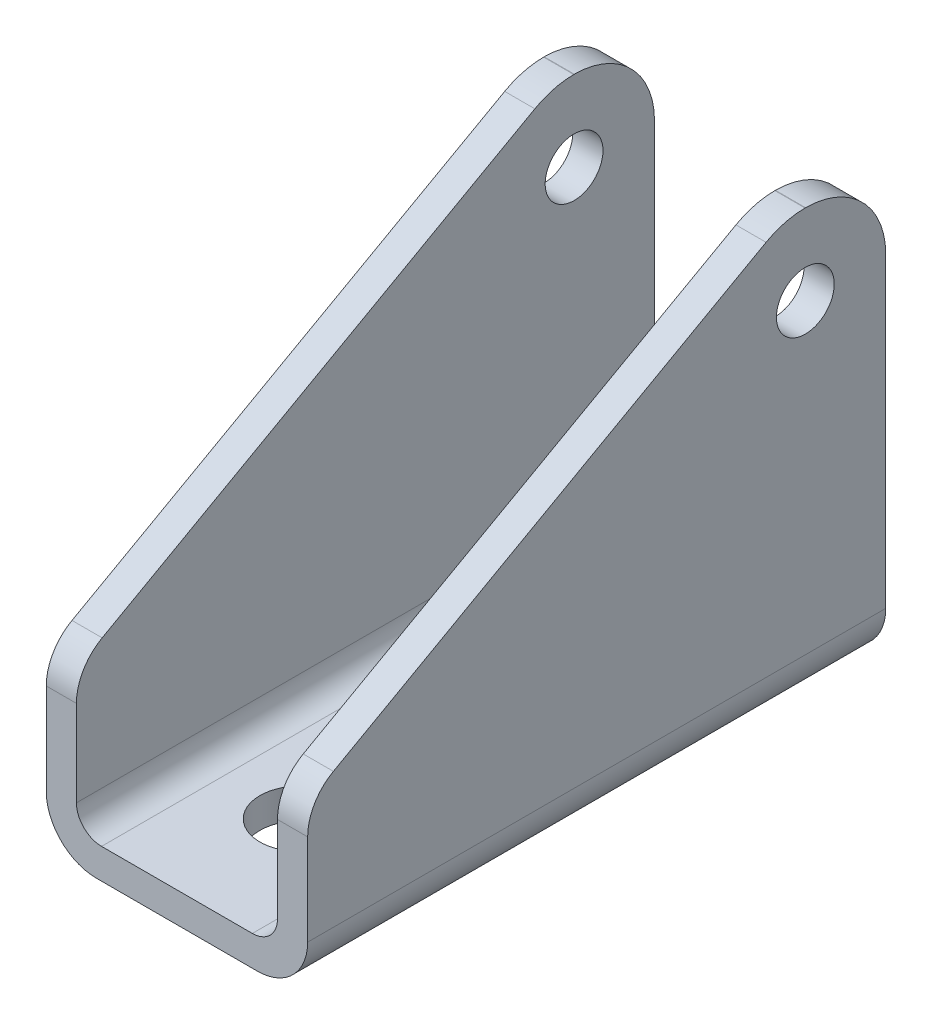
from build123d import *

# Parameters (mm, degrees)
BOSS_EXTRUDE1_DEPTH = 58.42
FILLET1_R           = 2.54
FILLET2_R           = 5.08
CUT_EXTRUDE1_START  = -26.416
CUT_EXTRUDE1_DEPTH  = 26.416
CUT_EXTRUDE2_START  = -26.416
CUT_EXTRUDE2_DEPTH  = 26.416
SKETCH2_5_R         = 2.921
CUT_EXTRUDE3_DEPTH  = 58.42
FILLET3_R           = 5.08
SKETCH4_R           = 4.064
CUT_EXTRUDE4_DEPTH  = 58.42


# Read off the part's stored shape, not the designer's step: Cut-Extrude1, Cut-Extrude2
with BuildPart() as part:
    # Sketch1 → Boss-Extrude1 (new body)
    with BuildSketch(Plane.XY):
        Polygon((-15.613299977, -11.899049236), (10.802700023, -11.899049236), (10.802700023, 32.296950764), (7.754700023, 32.296950764), (7.754700023, -8.851049236), (-12.565299977, -8.851049236), (-12.565299977, 32.296950764), (-15.613299977, 32.296950764), align=None)
    extrude(amount=-BOSS_EXTRUDE1_DEPTH)

    # Fillet1
    fillet1_edges = [part.edges().sort_by_distance(p)[0] for p in [
        (-12.565299977, -8.851049236, -29.21),
        (7.754700023, -8.851049236, -29.21),
    ]]
    fillet(fillet1_edges, radius=FILLET1_R)

    # Fillet2
    fillet2_edges = [part.edges().sort_by_distance(p)[0] for p in [
        (10.802700023, -11.899049236, -29.21),
        (-15.613299977, -11.899049236, -29.21),
    ]]
    fillet(fillet2_edges, radius=FILLET2_R)

    # Cut-Extrude1 outline → Cut-Extrude1 (cut)
    with BuildSketch(Plane(origin=(10.802700023, 0, 0), x_dir=(0, 0, -1), z_dir=(1, 0, 0)).offset(CUT_EXTRUDE1_START)):
        with BuildLine():
            Line((0, 32.296950764), (0, 5.372950764))
            Line((0, 5.372950764), (46.326645987, 31.26409951))
            ThreePointArc((46.326645987, 31.26409951), (48.229617736, 32.030995509), (50.263996941, 32.296950764))
            Line((50.263996941, 32.296950764), (0, 32.296950764))
        make_face()
    extrude(amount=CUT_EXTRUDE1_DEPTH, mode=Mode.SUBTRACT)

    # Cut-Extrude2 outline → Cut-Extrude2 (cut)
    with BuildSketch(Plane(origin=(10.802700023, 0, 0), x_dir=(0, 0, -1), z_dir=(1, 0, 0)).offset(CUT_EXTRUDE2_START)):
        with BuildLine():
            ThreePointArc((50.320003059, 32.296950764), (56.039398027, 29.916348791), (58.42, 24.196953823))
            Line((58.42, 24.196953823), (58.42, 32.296950764))
            Line((58.42, 32.296950764), (50.320003059, 32.296950764))
        make_face()
    extrude(amount=CUT_EXTRUDE2_DEPTH, mode=Mode.SUBTRACT)

    # Sketch2<5> → Cut-Extrude3 (cut)
    with BuildSketch(Plane(origin=(10.802700023, 0, 0), x_dir=(0, 0, -1), z_dir=(1, 0, 0))):
        with Locations((50.292, 24.168950764)):
            Circle(SKETCH2_5_R)
    extrude(amount=-CUT_EXTRUDE3_DEPTH, mode=Mode.SUBTRACT)

    # Fillet3
    fillet3_edges = [part.edges().sort_by_distance(p)[0] for p in [
        (-14.089299977, 5.372950764, 0),
        (9.278700023, 5.372950764, 0),
    ]]
    fillet(fillet3_edges, radius=FILLET3_R)

    # Sketch4 → Cut-Extrude4 (cut)
    with BuildSketch(Plane(origin=(0, -11.899049236, 0), x_dir=(-1, 0, 0), z_dir=(0, -1, 0))):
        with Locations(Location((2.405299977, 12.446, 0), (0, 0, 90))):
            Circle(SKETCH4_R)
        with BuildLine():
            ThreePointArc((-2.166700023, 48.514), (2.405299977, 43.942), (6.977299977, 48.514))
            Line((6.977299977, 48.514), (6.977299977, 58.42))
            Line((6.977299977, 58.42), (-2.166700023, 58.42))
            Line((-2.166700023, 58.42), (-2.166700023, 48.514))
        make_face()
    extrude(amount=-CUT_EXTRUDE4_DEPTH, mode=Mode.SUBTRACT)


solid = part.part
